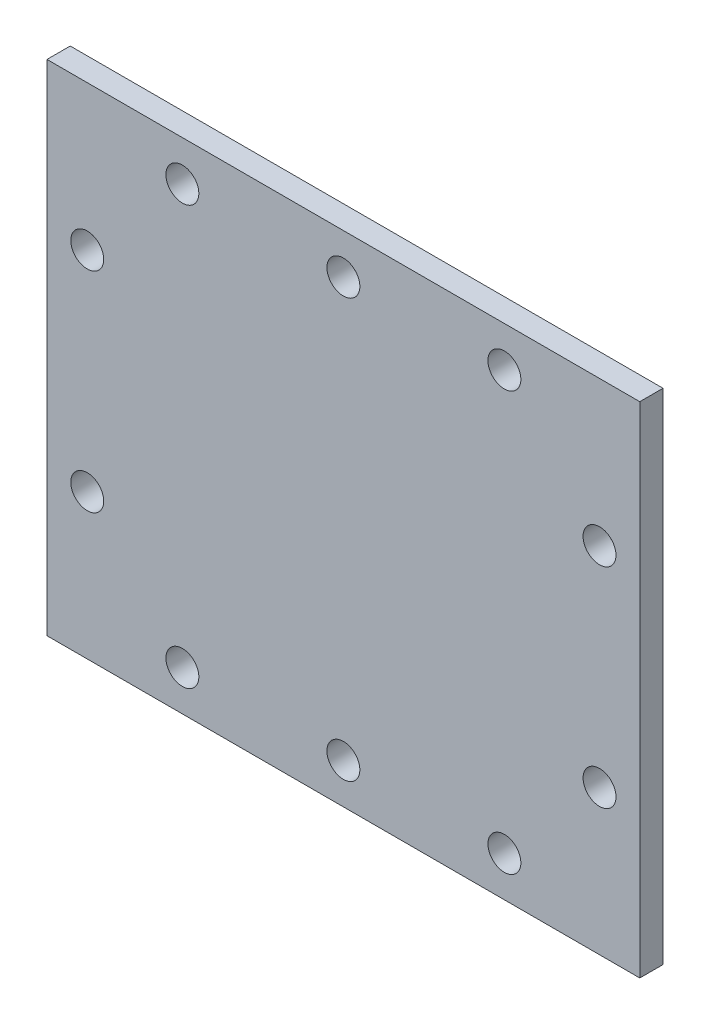
from build123d import *

# Parameters (mm, degrees)
SKETCH1_W                  = 81
SKETCH1_H                  = 68.2
WINDOW_POLYCARBONATE_DEPTH = 3.175
F_10X_CLEARANCE_HOLE_M4_D  = 4.5


with BuildPart() as part:
    # Sketch1 → Window, Polycarbonate (new body)
    with BuildSketch(Plane.XY):
        with Locations((40.5, 34.1)):
            Rectangle(SKETCH1_W, SKETCH1_H)
    extrude(amount=WINDOW_POLYCARBONATE_DEPTH)

    # 10X, Clearance Hole, M4 (through all)
    with Locations(Plane.XY.offset(3.175)):
        with Locations((40.5, 5.5), (62.5, 5.5), (18.5, 5.5), (5.5, 19.8), (5.5, 48.4), (18.5, 62.7), (62.5, 62.7), (75.5, 48.4), (75.5, 19.8), (-14.096993723, 58.717542121), (40.5, 62.7), (-22.097522299, 69.695011563)):
            Hole(F_10X_CLEARANCE_HOLE_M4_D / 2)


solid = part.part
